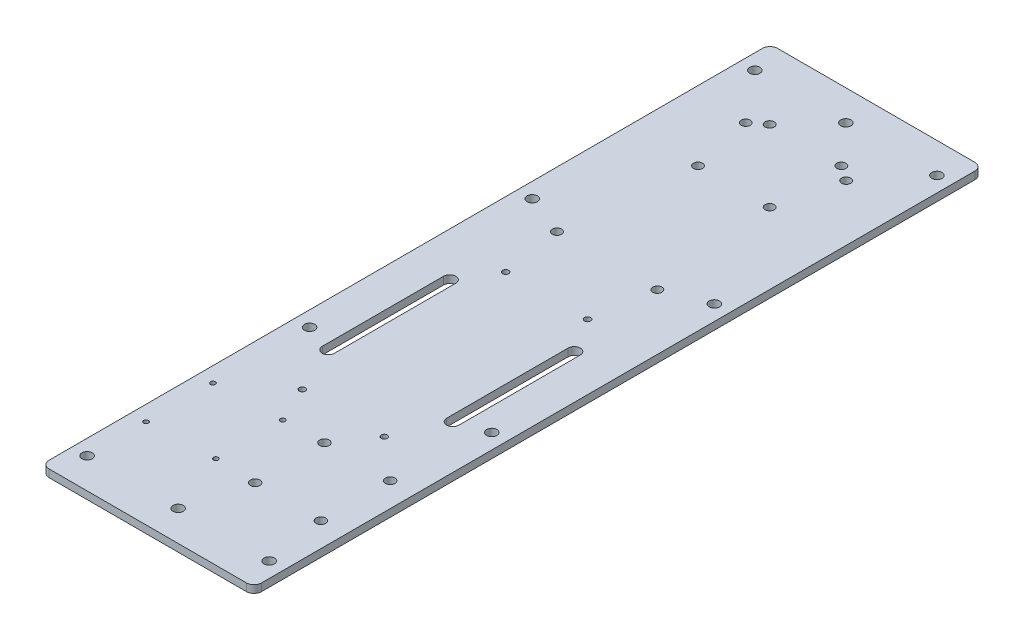
from build123d import *

# Parameters (mm, degrees)
PLATE_THICKNESS_DEPTH        = 3.175
SKETCH3_R                    = 2.159
MOUNTING_HOLES_DEPTH         = 159.781746826
SKETCH4_R                    = 1.905
JETSON_HOLES_W_O_MOUNT_DEPTH = 159.781746826
SKETCH5_R                    = 1.905
PDB_HOLES_DEPTH              = 159.781746826
SKETCH7_R                    = 1.27
PIXHAWK_HOLES_DEPTH          = 159.781746826
BATTERY_HOLES_DEPTH          = 159.781746826
SKETCH9_R                    = 2
CUT_EXTRUDE1_DEPTH           = 159.781746826
VENTRAL_CAMERA_HOLES_REACH   = 160.782
SKETCH10_R                   = 1


with BuildPart() as part:
    # Sketch2 → Plate Thickness (new body)
    with BuildSketch(Plane(origin=(0, 0, 0), x_dir=(1, 0, 0), z_dir=(0, 1, 0))):
        with BuildLine():
            Line((-41.275, 152.4), (41.275, 152.4))
            ThreePointArc((41.275, 152.4), (43.52006403, 151.47006403), (44.45, 149.225))
            Line((44.45, 149.225), (44.45, -149.225))
            ThreePointArc((44.45, -149.225), (43.52006403, -151.47006403), (41.275, -152.4))
            Line((41.275, -152.4), (-41.275, -152.4))
            ThreePointArc((-41.275, -152.4), (-43.52006403, -151.47006403), (-44.45, -149.225))
            Line((-44.45, -149.225), (-44.45, 149.225))
            ThreePointArc((-44.45, 149.225), (-43.52006403, 151.47006403), (-41.275, 152.4))
        make_face()
    extrude(amount=PLATE_THICKNESS_DEPTH)

    # Sketch3 → Mounting holes (cut, through all)
    with BuildSketch(Plane(origin=(0, 3.175, 0), x_dir=(1, 0, 0), z_dir=(0, 1, 0))):
        with Locations((-38.1, 139.7)):
            Circle(SKETCH3_R)
        with Locations((-38.1, 46.566666666)):
            Circle(SKETCH3_R)
        with Locations((-38.1, -46.56666582)):
            Circle(SKETCH3_R)
        with Locations((-38.1, -139.7)):
            Circle(SKETCH3_R)
        with Locations((38.1, -139.7)):
            Circle(SKETCH3_R)
        with Locations((38.1, -46.56666582)):
            Circle(SKETCH3_R)
        with Locations((38.1, 46.566666666)):
            Circle(SKETCH3_R)
        with Locations((38.1, 139.7)):
            Circle(SKETCH3_R)
        with Locations((0, 139.7)):
            Circle(SKETCH3_R)
        with Locations((0, -139.7)):
            Circle(SKETCH3_R)
    extrude(amount=-MOUNTING_HOLES_DEPTH, mode=Mode.SUBTRACT)

    # Sketch4 → Jetson Holes (w/o mount) (cut, through all)
    with BuildSketch(Plane(origin=(0, 3.175, 0), x_dir=(1, 0, 0), z_dir=(0, 1, 0))):
        with Locations((-21.0058, 118.808268359)):
            Circle(SKETCH4_R)
        with Locations((-21.0058, 39.814268359)):
            Circle(SKETCH4_R)
        with Locations((21.0058, 39.814268359)):
            Circle(SKETCH4_R)
        with Locations((21.0058, 118.808268359)):
            Circle(SKETCH4_R)
    extrude(amount=-JETSON_HOLES_W_O_MOUNT_DEPTH, mode=Mode.SUBTRACT)

    # Sketch5 → PDB holes (cut, through all)
    with BuildSketch(Plane(origin=(0, 3.175, 0), x_dir=(1, 0, 0), z_dir=(0, 1, 0))):
        with Locations((-15.378405846, 123.19)):
            Circle(SKETCH5_R)
        with Locations((14.618994154, 123.19)):
            Circle(SKETCH5_R)
        with Locations((14.618994154, 93.1926)):
            Circle(SKETCH5_R)
        with Locations((-15.378405846, 93.1926)):
            Circle(SKETCH5_R)
    extrude(amount=-PDB_HOLES_DEPTH, mode=Mode.SUBTRACT)

    # Sketch7 → PixHawk Holes (cut, through all)
    with BuildSketch(Plane(origin=(0, 3.175, 0), x_dir=(1, 0, 0), z_dir=(0, 1, 0))):
        with Locations((-17.145, 14.489268954)):
            Circle(SKETCH7_R)
        with Locations((-17.145, -70.600731046)):
            Circle(SKETCH7_R)
        with Locations((17.145, -70.600731046)):
            Circle(SKETCH7_R)
        with Locations((17.145, 14.489268954)):
            Circle(SKETCH7_R)
    extrude(amount=-PIXHAWK_HOLES_DEPTH, mode=Mode.SUBTRACT)

    # Sketch8 → Battery Holes (cut, through all)
    with BuildSketch(Plane(origin=(0, 3.175, 0), x_dir=(1, 0, 0), z_dir=(0, 1, 0))):
        with BuildLine():
            Line((-23.495, -0.005964701), (-23.495, -50.805964701))
            ThreePointArc((-23.495, -50.805964701), (-26.035, -53.345964701), (-28.575, -50.805964701))
            Line((-28.575, -50.805964701), (-28.575, -0.005964701))
            ThreePointArc((-28.575, -0.005964701), (-26.035, 2.534035299), (-23.495, -0.005964701))
        make_face()
        with BuildLine():
            Line((23.495, -0.005964701), (23.495, -50.805964701))
            ThreePointArc((23.495, -50.805964701), (26.035, -53.345964701), (28.575, -50.805964701))
            Line((28.575, -50.805964701), (28.575, -0.005964701))
            ThreePointArc((28.575, -0.005964701), (26.035, 2.534035299), (23.495, -0.005964701))
        make_face()
    extrude(amount=-BATTERY_HOLES_DEPTH, mode=Mode.SUBTRACT)

    # Sketch9 → Cut-Extrude1 (cut, through all)
    with BuildSketch(Plane(origin=(0, 3.175, 0), x_dir=(1, 0, 0), z_dir=(0, 1, 0))):
        with Locations((6.833401633, -85.3)):
            Circle(SKETCH9_R)
        with Locations((34.333401633, -85.3)):
            Circle(SKETCH9_R)
        with Locations((34.333401633, -114.3)):
            Circle(SKETCH9_R)
        with Locations((6.833401633, -114.3)):
            Circle(SKETCH9_R)
    extrude(amount=-CUT_EXTRUDE1_DEPTH, mode=Mode.SUBTRACT)

    # Sketch10 → Ventral Camera holes (cut, up to next)
    with BuildSketch(Plane(origin=(0, 3.175, 0), x_dir=(1, 0, 0), z_dir=(0, 1, 0)), mode=Mode.PRIVATE) as ventral_camera_holes_sk1:
        with Locations((-38.125460092, -87.008641581)):
            Circle(SKETCH10_R)
    ventral_camera_holes_tool1 = extrude(ventral_camera_holes_sk1.sketch, amount=-VENTRAL_CAMERA_HOLES_REACH, mode=Mode.PRIVATE) & part.part
    # Sketch10 → Ventral Camera holes (cut, up to next)
    with BuildSketch(Plane(origin=(0, 3.175, 0), x_dir=(1, 0, 0), z_dir=(0, 1, 0)), mode=Mode.PRIVATE) as ventral_camera_holes_sk2:
        with Locations((-38.1, -115.008630005)):
            Circle(SKETCH10_R)
    ventral_camera_holes_tool2 = extrude(ventral_camera_holes_sk2.sketch, amount=-VENTRAL_CAMERA_HOLES_REACH, mode=Mode.PRIVATE) & part.part
    # Sketch10 → Ventral Camera holes (cut, up to next)
    with BuildSketch(Plane(origin=(0, 3.175, 0), x_dir=(1, 0, 0), z_dir=(0, 1, 0)), mode=Mode.PRIVATE) as ventral_camera_holes_sk3:
        with Locations((-10.126568972, -85.789139736)):
            Circle(SKETCH10_R)
    ventral_camera_holes_tool3 = extrude(ventral_camera_holes_sk3.sketch, amount=-VENTRAL_CAMERA_HOLES_REACH, mode=Mode.PRIVATE) & part.part
    # Sketch10 → Ventral Camera holes (cut, up to next)
    with BuildSketch(Plane(origin=(0, 3.175, 0), x_dir=(1, 0, 0), z_dir=(0, 1, 0)), mode=Mode.PRIVATE) as ventral_camera_holes_sk4:
        with Locations((-10.126568972, -113.789139736)):
            Circle(SKETCH10_R)
    ventral_camera_holes_tool4 = extrude(ventral_camera_holes_sk4.sketch, amount=-VENTRAL_CAMERA_HOLES_REACH, mode=Mode.PRIVATE) & part.part
    add(ventral_camera_holes_tool1.solids().sort_by_distance((-38.12546, 3.175, 87.008642))[0], mode=Mode.SUBTRACT)
    add(ventral_camera_holes_tool2.solids().sort_by_distance((-38.1, 3.175, 115.00863))[0], mode=Mode.SUBTRACT)
    add(ventral_camera_holes_tool3.solids().sort_by_distance((-10.126569, 3.175, 85.78914))[0], mode=Mode.SUBTRACT)
    add(ventral_camera_holes_tool4.solids().sort_by_distance((-10.126569, 3.175, 113.78914))[0], mode=Mode.SUBTRACT)


solid = part.part
